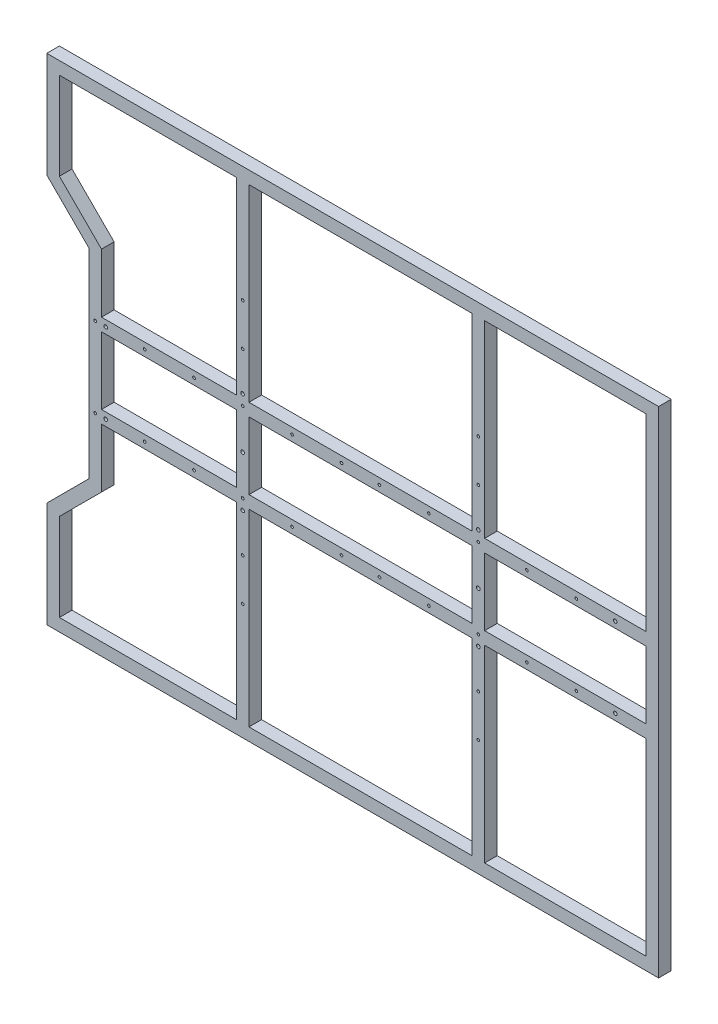
from build123d import *

# Parameters (mm, degrees)
SKETCH_2_W          = 265
SKETCH_2_H          = 224
SKETCH_2_W_2        = 191.700177837
SKETCH_2_W_3        = 160.200177837
SKETCH_2_H_2        = 80
EXTRUDE_1_DEPTH     = 15
SKETCH_3_R          = 2.15
SKETCH_3_R_2        = 1.6
SKETCH_3_R_3        = 2.240696867
CUT_EXTRUDE_1_DEPTH = 15


with BuildPart() as part:
    # 草图2 → 凸台-拉伸1 (new body)
    with BuildSketch(Plane.XY):
        Polygon((-362.700177837, 294), (-372.700177837, 294), (-372.700177837, 184.842706176), (-372.700177837, 168.786796564), (-322.700177837, 118.786796564), (-322.700177837, 55), (-322.700177837, 40.009301689), (-322.700177837, -40.009301689), (-322.700177837, -55), (-322.700177837, -118.786796564), (-372.700177837, -168.786796564), (-372.700177837, -184.842706176), (-372.700177837, -294), (-362.700177837, -294), (-147.5, -294), (-132.5, -294), (132.5, -294), (147.5, -294), (346.200177837, -294), (354.200177837, -294), (354.200177837, -55), (354.200177837, -40), (354.200177837, 40), (354.200177837, 55), (354.200177837, 294), (346.200177837, 294), (147.5, 294), (132.5, 294), (-132.5, 294), (-147.5, 294), align=None)
        Polygon((-357.700177837, -175), (-307.700177837, -125), (-307.700177837, -105), (-307.700177837, -55), (-147.5, -55), (-147.5, -279), (-357.700177837, -279), align=None, mode=Mode.SUBTRACT)
        with Locations((0, -167)):
            Rectangle(SKETCH_2_W, SKETCH_2_H, mode=Mode.SUBTRACT)
        with Locations((243.350088919, -167)):
            Rectangle(SKETCH_2_W_2, SKETCH_2_H, mode=Mode.SUBTRACT)
        with Locations((-227.600088919, 0)):
            Rectangle(SKETCH_2_W_3, SKETCH_2_H_2, mode=Mode.SUBTRACT)
        Polygon((-357.700177837, 175), (-357.700177837, 279), (-147.5, 279), (-147.5, 55), (-307.700177837, 55), (-307.700177837, 105), (-307.700177837, 125), align=None, mode=Mode.SUBTRACT)
        Rectangle(SKETCH_2_W, SKETCH_2_H_2, mode=Mode.SUBTRACT)
        with Locations((243.350088919, 0)):
            Rectangle(SKETCH_2_W_2, SKETCH_2_H_2, mode=Mode.SUBTRACT)
        with Locations((0, 167)):
            Rectangle(SKETCH_2_W, SKETCH_2_H, mode=Mode.SUBTRACT)
        with Locations((243.350088919, 167)):
            Rectangle(SKETCH_2_W_2, SKETCH_2_H, mode=Mode.SUBTRACT)
    extrude(amount=EXTRUDE_1_DEPTH)

    # 草图3 → 切除-拉伸1 (cut)
    with BuildSketch(Plane.XY.offset(15)):
        with Locations((-140, 60)):
            Circle(SKETCH_3_R)
        with Locations((-315.200177837, 47.5)):
            Circle(SKETCH_3_R_2)
        with Locations((-256.466844504, 47.5)):
            Circle(SKETCH_3_R_2)
        with Locations((-197.736844504, 47.5)):
            Circle(SKETCH_3_R_2)
        with Locations((-140, 47.5)):
            Circle(SKETCH_3_R_2)
        with Locations((-140, 156.23)):
            Circle(SKETCH_3_R_2)
        with Locations((-140, 106.23)):
            Circle(SKETCH_3_R_2)
        with Locations((-81.27, 47.5)):
            Circle(SKETCH_3_R_2)
        with Locations((-22.54, 47.5)):
            Circle(SKETCH_3_R_2)
        with Locations((-140, 0)):
            Circle(SKETCH_3_R_3)
        with Locations((-302.700177837, 47.5)):
            Circle(SKETCH_3_R)
        with Locations((-302.700177837, -47.5)):
            Circle(SKETCH_3_R)
        with Locations((-22.54, -47.5)):
            Circle(SKETCH_3_R_2)
        with Locations((-81.27, -47.5)):
            Circle(SKETCH_3_R_2)
        with Locations((-140, -106.23)):
            Circle(SKETCH_3_R_2)
        with Locations((-140, -156.23)):
            Circle(SKETCH_3_R_2)
        with Locations((-140, -47.5)):
            Circle(SKETCH_3_R_2)
        with Locations((-197.736844504, -47.5)):
            Circle(SKETCH_3_R_2)
        with Locations((-256.466844504, -47.5)):
            Circle(SKETCH_3_R_2)
        with Locations((-315.200177837, -47.5)):
            Circle(SKETCH_3_R_2)
        with Locations((-140, -60)):
            Circle(SKETCH_3_R)
        with Locations((140, -60)):
            Circle(SKETCH_3_R)
        with Locations((256.466844504, -47.5)):
            Circle(SKETCH_3_R_2)
        with Locations((197.736844504, -47.5)):
            Circle(SKETCH_3_R_2)
        with Locations((140, -47.5)):
            Circle(SKETCH_3_R_2)
        with Locations((140, -156.23)):
            Circle(SKETCH_3_R_2)
        with Locations((140, -106.23)):
            Circle(SKETCH_3_R_2)
        with Locations((81.27, -47.5)):
            Circle(SKETCH_3_R_2)
        with Locations((22.54, -47.5)):
            Circle(SKETCH_3_R_2)
        with Locations((302.700177837, -47.5)):
            Circle(SKETCH_3_R)
        with Locations((302.700177837, 47.5)):
            Circle(SKETCH_3_R)
        with Locations((140, 0)):
            Circle(SKETCH_3_R_3)
        with Locations((22.54, 47.5)):
            Circle(SKETCH_3_R_2)
        with Locations((81.27, 47.5)):
            Circle(SKETCH_3_R_2)
        with Locations((140, 106.23)):
            Circle(SKETCH_3_R_2)
        with Locations((140, 156.23)):
            Circle(SKETCH_3_R_2)
        with Locations((140, 47.5)):
            Circle(SKETCH_3_R_2)
        with Locations((197.736844504, 47.5)):
            Circle(SKETCH_3_R_2)
        with Locations((256.466844504, 47.5)):
            Circle(SKETCH_3_R_2)
        with Locations((140, 60)):
            Circle(SKETCH_3_R)
    extrude(amount=-CUT_EXTRUDE_1_DEPTH, mode=Mode.SUBTRACT)


solid = part.part
